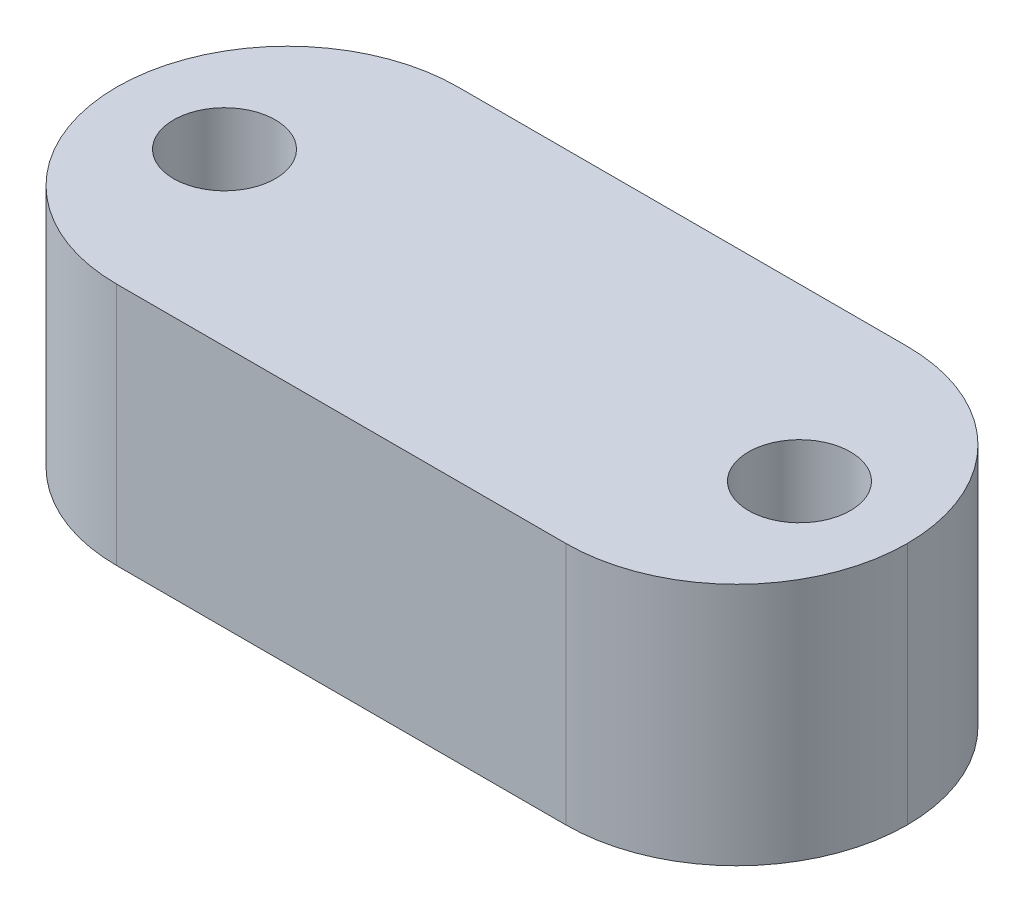
from build123d import *

# Parameters (mm, degrees)
SKETCH1_W            = 34.925
SKETCH1_H            = 15.08125
EXTRUDE1_DEPTH       = 10.7696
M4_CLEARANCE_HOLE1_D = 4.5
FILLET1_R            = 7.540625


with BuildPart() as part:
    # Sketch1 → Extrude1 (new body)
    with BuildSketch(Plane(origin=(0, 0, 0), x_dir=(1, 0, 0), z_dir=(0, 1, 0))):
        Rectangle(SKETCH1_W, SKETCH1_H)
    extrude(amount=EXTRUDE1_DEPTH)

    # M4 Clearance Hole1 (through all)
    with Locations(Plane(origin=(0, 10.7696, 0), x_dir=(-1, 0, 0), z_dir=(0, 1, 0))):
        with Locations((12.7, 0), (-12.7, 0)):
            Hole(M4_CLEARANCE_HOLE1_D / 2)

    # Fillet1
    fillet1_edges = [part.edges().sort_by_distance(p)[0] for p in [
        (17.4625, 5.3848, 7.540625),
        (17.4625, 5.3848, -7.540625),
        (-17.4625, 5.3848, -7.540625),
        (-17.4625, 5.3848, 7.540625),
    ]]
    fillet(fillet1_edges, radius=FILLET1_R - 0.0001)  # a hair under: the kernel refuses the full size


solid = part.part
